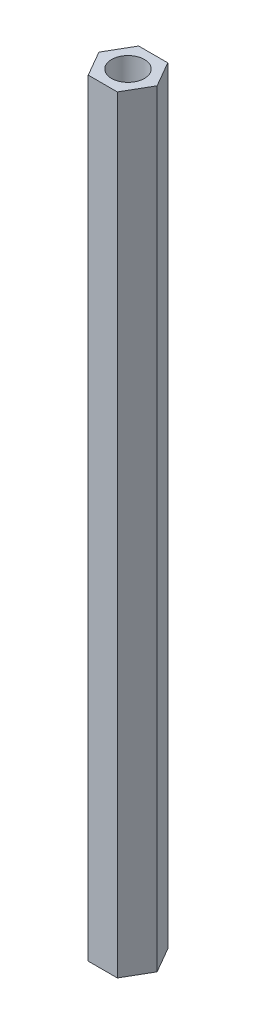
from build123d import *

# Parameters (mm, degrees)
SKETCH1_R           = 1.5
BOSS_EXTRUDE1_DEPTH = 70


with BuildPart() as part:
    # Sketch1 → Boss-Extrude1 (new body)
    with BuildSketch(Plane(origin=(0, 0, 0), x_dir=(1, 0, 0), z_dir=(0, 1, 0))):
        Polygon((2.655811238, 0), (1.327905619, 2.3), (-1.327905619, 2.3), (-2.655811238, 0), (-1.327905619, -2.3), (1.327905619, -2.3), align=None)
        Circle(SKETCH1_R, mode=Mode.SUBTRACT)
    extrude(amount=BOSS_EXTRUDE1_DEPTH)


solid = part.part
